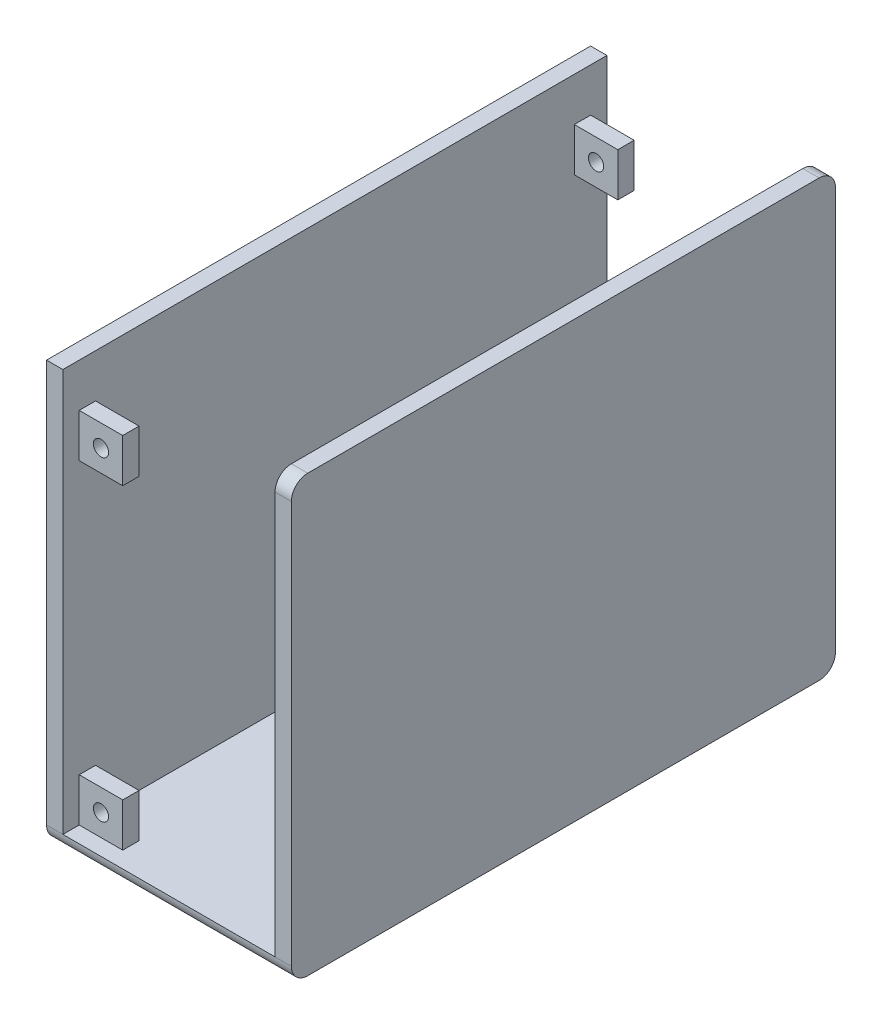
from build123d import *

# Parameters (mm, degrees)
BOSS_EXTRUDE1_DEPTH                        = 100
SKETCH2_W                                  = 3
SKETCH2_H                                  = 8
BOSS_EXTRUDE2_DEPTH                        = 8
MIRROR1_AT_THE_SECOND_PLANE_COPY_1_SKETC_W = 3
MIRROR1_AT_THE_SECOND_PLANE_COPY_1_SKETC_H = 8
MIRROR1_AT_THE_SECOND_PLANE_COPY_1_DEPTH   = 8
SKETCH3_R                                  = 1.4
CUT_EXTRUDE1_DEPTH                         = 134.54400024
FILLET1_START                              = -46
FILLET1_DEPTH                              = 47


with BuildPart() as part:
    # Sketch1 → Boss-Extrude1 (new body)
    with BuildSketch(Plane.XY):
        Polygon((-3, 80), (0, 80), (0, 0), (-45, 0), (-45, 77), (-42, 77), (-42, 3), (-3, 3), align=None)
    extrude(amount=BOSS_EXTRUDE1_DEPTH)

    # Sketch2 → Boss-Extrude2 (add)
    with BuildSketch(Plane(origin=(-42, 0, 0), x_dir=(0, 0, -1), z_dir=(1, 0, 0))):
        with Locations((-95.5, 7)):
            Rectangle(SKETCH2_W, SKETCH2_H)
    boss_extrude2 = extrude(amount=BOSS_EXTRUDE2_DEPTH)

    # Mirror1: Boss-Extrude2 across plane
    add(boss_extrude2.mirror(Plane.ZX.offset(36)))

    # Mirror1 at the second plane: Boss-Extrude2 across plane
    add(boss_extrude2.mirror(Plane.XY.offset(50)))

    # Mirror1 at the second plane copy 1 sketc → Mirror1 at the second plane copy 1 (add)
    with BuildSketch(Plane(origin=(-42, 72, 100), x_dir=(0, 0, 1), z_dir=(1, 0, 0))):
        with Locations((-95.5, 7)):
            Rectangle(MIRROR1_AT_THE_SECOND_PLANE_COPY_1_SKETC_W, MIRROR1_AT_THE_SECOND_PLANE_COPY_1_SKETC_H)
    extrude(amount=MIRROR1_AT_THE_SECOND_PLANE_COPY_1_DEPTH)

    # Sketch3 → Cut-Extrude1 (cut, through all)
    with BuildSketch(Plane.XY.offset(97)):
        with Locations((-38, 7)):
            Circle(SKETCH3_R)
    cut_extrude1 = extrude(amount=-CUT_EXTRUDE1_DEPTH, mode=Mode.SUBTRACT)

    # Mirror2: Cut-Extrude1 across plane
    add(cut_extrude1.mirror(Plane.ZX.offset(36)), mode=Mode.SUBTRACT)

    # Fillet1: read off the stored shape, not the designer's step
    # Fillet1 outline → Fillet1 (cut)
    with BuildSketch(Plane.YZ.offset(FILLET1_START)):
        with BuildLine():
            Line((80, 0), (80, 3))
            ThreePointArc((80, 3), (79.121320344, 0.878679656), (77, 0))
            Line((77, 0), (80, 0))
        make_face()
        with BuildLine():
            ThreePointArc((77, 100), (79.121320344, 99.121320344), (80, 97))
            Line((80, 97), (80, 100))
            Line((80, 100), (77, 100))
        make_face()
        with BuildLine():
            Line((0, 0), (3, 0))
            ThreePointArc((3, 0), (0.878679656, 0.878679656), (0, 3))
            Line((0, 3), (0, 0))
        make_face()
        with BuildLine():
            ThreePointArc((0, 97), (0.878679656, 99.121320344), (3, 100))
            Line((3, 100), (0, 100))
            Line((0, 100), (0, 97))
        make_face()
    extrude(amount=FILLET1_DEPTH, mode=Mode.SUBTRACT)


solid = part.part
